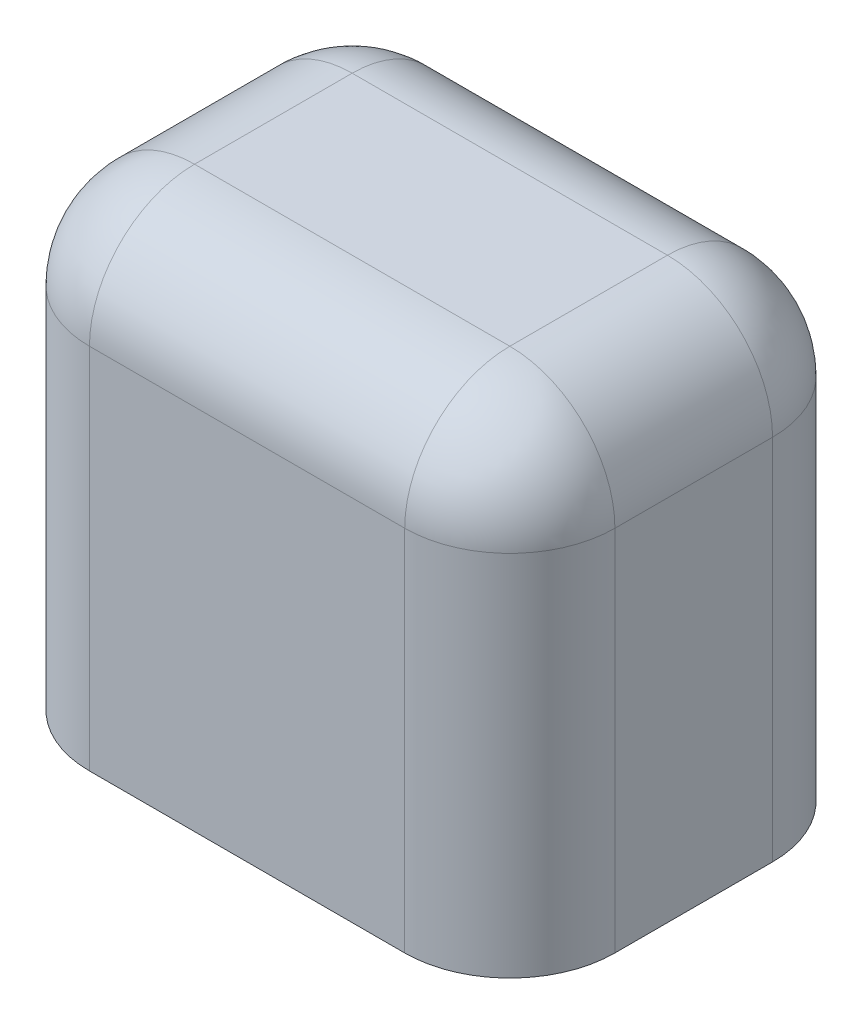
from build123d import *

# Parameters (mm, degrees)
SALIENTE_EXTRUIR2_DEPTH = 45
REDONDEO2_R             = 10
VACIADO1_T              = -1.95


with BuildPart() as part:
    # Croquis1 → Saliente-Extruir2 (new body)
    with BuildSketch(Plane(origin=(0, 0, 0), x_dir=(1, 0, 0), z_dir=(0, 1, 0))):
        with BuildLine():
            Line((-15, 17.5), (15, 17.5))
            ThreePointArc((15, 17.5), (22.071067812, 14.571067812), (25, 7.5))
            Line((25, 7.5), (25, -7.5))
            ThreePointArc((25, -7.5), (22.071067812, -14.571067812), (15, -17.5))
            Line((15, -17.5), (-15, -17.5))
            ThreePointArc((-15, -17.5), (-22.071067812, -14.571067812), (-25, -7.5))
            Line((-25, -7.5), (-25, 7.5))
            ThreePointArc((-25, 7.5), (-22.071067812, 14.571067812), (-15, 17.5))
        make_face()
    extrude(amount=SALIENTE_EXTRUIR2_DEPTH)

    # Redondeo2
    redondeo2_edges = [part.edges().sort_by_distance(p)[0] for p in [
        (-22.071067812, 45, 14.571067812),
        (-25, 45, 0),
        (-22.071067812, 45, -14.571067812),
        (0, 45, -17.5),
        (22.071067812, 45, -14.571067812),
        (25, 45, 0),
        (22.071067812, 45, 14.571067812),
        (0, 45, 17.5),
    ]]
    fillet(redondeo2_edges, radius=REDONDEO2_R)

    # Vaciado1
    vaciado1_openings = [part.faces().sort_by_distance(p)[0] for p in [
        (0, 0, 0),
    ]]
    offset(amount=VACIADO1_T, openings=vaciado1_openings, kind=Kind.INTERSECTION)


solid = part.part
